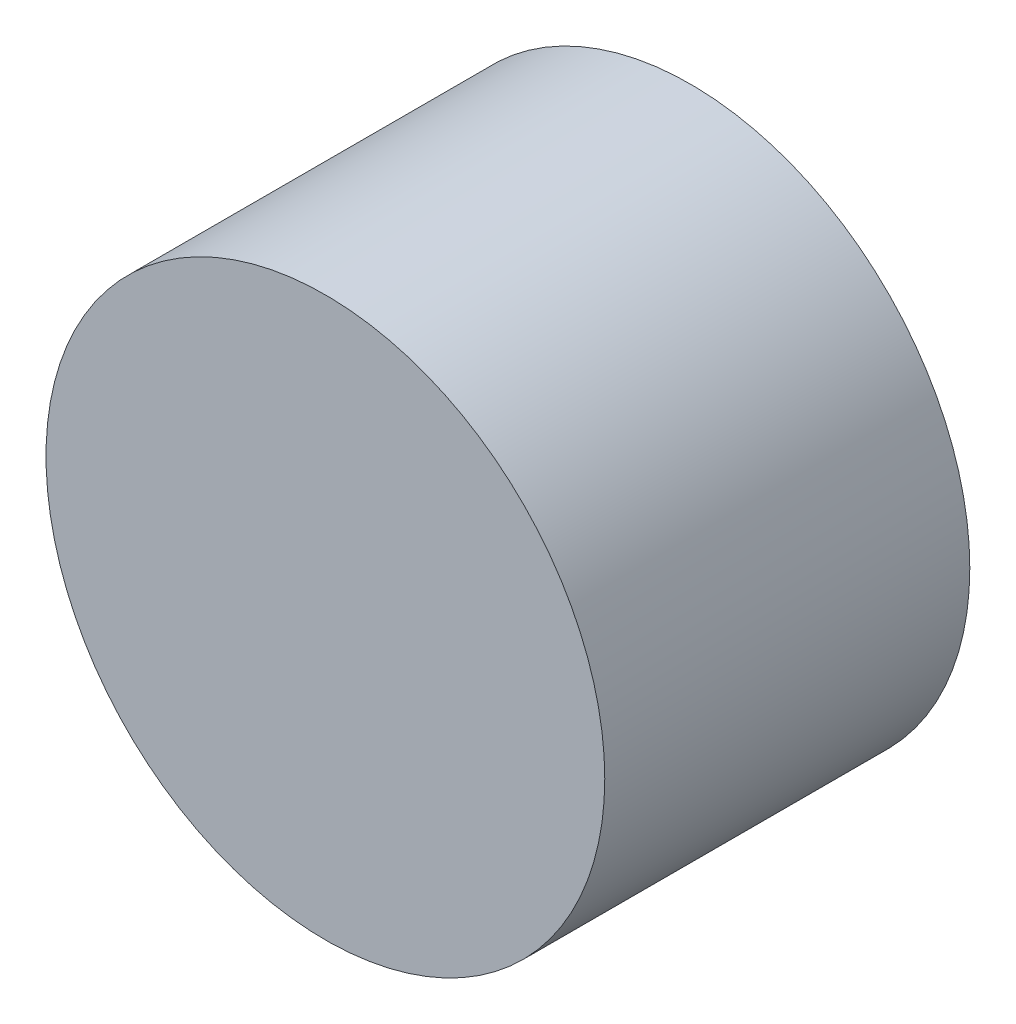
from build123d import *

# Parameters (mm, degrees)
BOSS_EXTRUDE2_DEPTH      = 70
BOSS_EXTRUDE2_DEPTH_BACK = 70
SKETCH2_R                = 107.15


with BuildPart() as part:
    # Sketch2 → Boss-Extrude2 (new, two sides: drawn at the far end of the back side and taken through both)
    with BuildSketch(Plane.XY.offset(-BOSS_EXTRUDE2_DEPTH_BACK)):
        Circle(SKETCH2_R)
    extrude(amount=BOSS_EXTRUDE2_DEPTH + BOSS_EXTRUDE2_DEPTH_BACK)


solid = part.part
